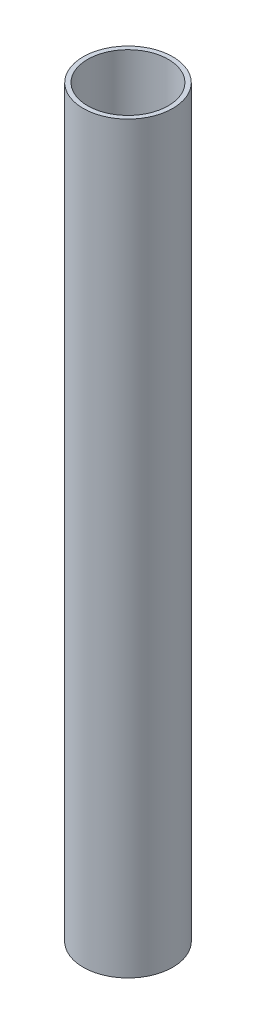
from build123d import *

# Parameters (mm, degrees)
SKETCH1_R           = 10
SKETCH1_R_2         = 9
BOSS_EXTRUDE1_DEPTH = 166.1


with BuildPart() as part:
    # Sketch1 → Boss-Extrude1 (new body)
    with BuildSketch(Plane(origin=(0, 0, 0), x_dir=(1, 0, 0), z_dir=(0, 1, 0))):
        Circle(SKETCH1_R)
        Circle(SKETCH1_R_2, mode=Mode.SUBTRACT)
    extrude(amount=BOSS_EXTRUDE1_DEPTH)


solid = part.part
